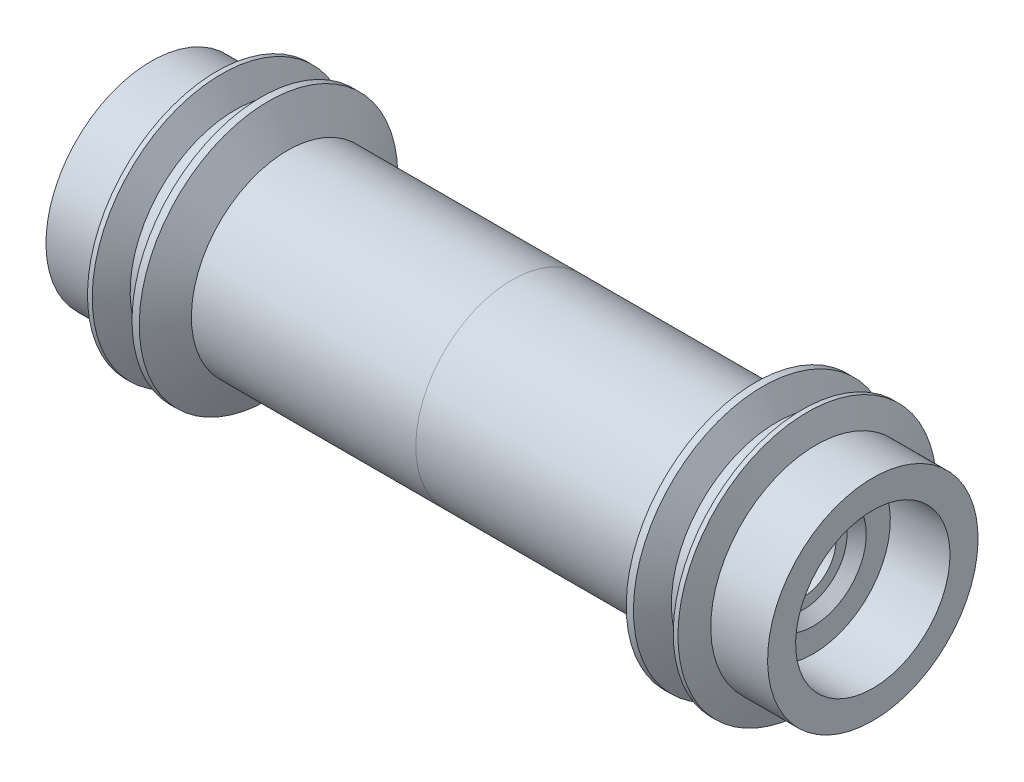
from build123d import *

# Parameters (mm, degrees)
CHAMFER1_SIZE = 0.508


with BuildPart() as part:
    # Sketch2 → Revolve1 (revolve)
    with BuildSketch(Plane.XY):
        Polygon((-16.05, 5.55625), (-19.05, 5.55625), (-19.05, 4.075), (-15.9, 4.075), (-15.9, 2.805), (-15.392, 2.297), (-15.392, 1.7145), (-9.225, 1.7145), (-9.225, 0), (-8.1, 0), (-6.5, 1.6), (0, 1.6), (0, 5.08), (-11.847567251, 5.08), (-12.855765158, 6.82625), (-13.236765158, 6.82625), (-13.97, 5.55625), (-14.605, 5.55625), (-15.338234842, 6.82625), (-15.587757802, 6.82625), align=None)
    revolve(axis=Axis((-19.05, 0, 0), (1, 0, 0)))


with BuildPart() as body_2:
    # Mirror1: mirrored copy
    add(part.part.mirror(Plane(origin=(0, 0, 0), x_dir=(0, 0, 1), z_dir=(1, 0, 0))))


with BuildPart() as part_1:
    add(part.part)

    # Chamfer1
    chamfer1_edges = [part_1.edges().sort_by_distance(p)[0] for p in [
        (-19.05, -4.075, 0),
    ]]
    chamfer(chamfer1_edges, length=CHAMFER1_SIZE)


solid = Compound([body_2.part, part_1.part])
